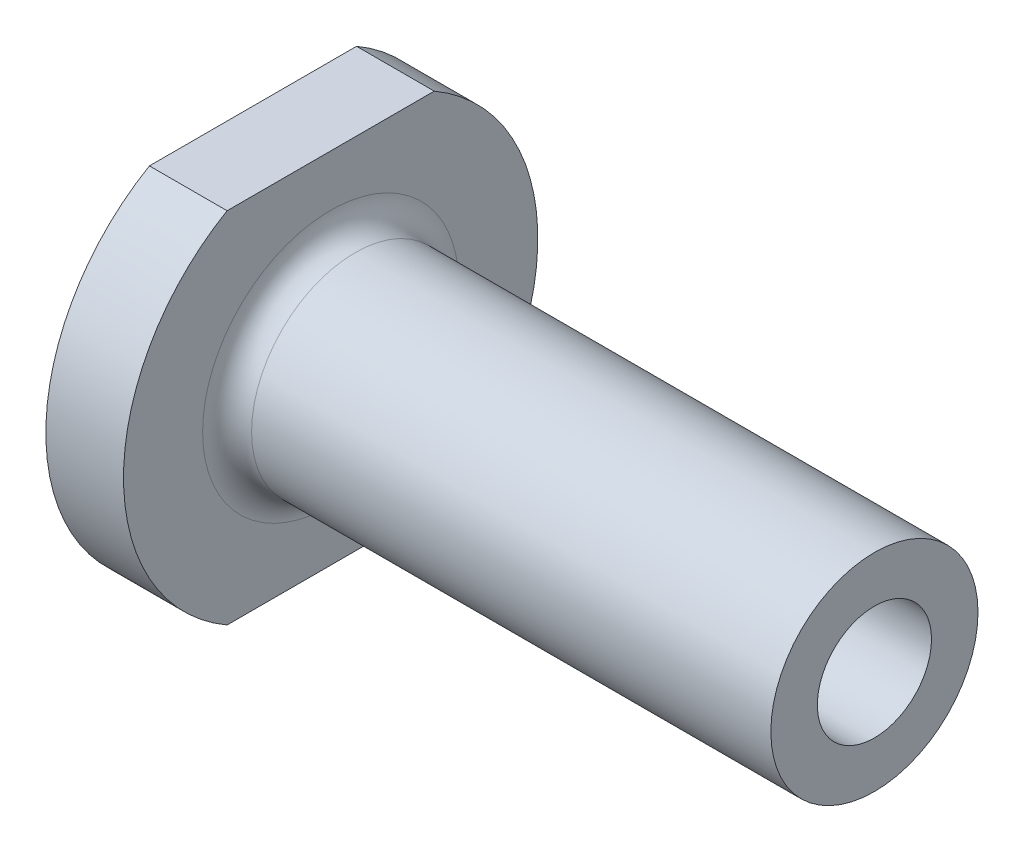
from build123d import *

# Parameters (mm, degrees)
FILLET1_R                            = 1.5
F_5_16_18_MAKE_SURE_TO_CHANGE_THIS_D = 7
CUT_EXTRUDE1_DEPTH                   = 43.121134838


with BuildPart() as part:
    # Sketch1 → Revolve1 (revolve)
    with BuildSketch(Plane.XY):
        Polygon((0, 0), (38.1, 0), (38.1, 6.35), (4.7625, 6.35), (4.7625, 12.7), (0, 12.7), align=None)
    revolve(axis=Axis((0, 0, 0), (-1, 0, 0)))

    # Fillet1
    fillet1_edges = [part.edges().sort_by_distance(p)[0] for p in [
        (4.7625, -6.35, 0),
    ]]
    fillet(fillet1_edges, radius=FILLET1_R)

    # 5/16-18 MAKE SURE TO CHANGE THIS (through all)
    with Locations(Plane(origin=(38.1, 0, 0), x_dir=(0, 0, -1), z_dir=(1, 0, 0))):
        with Locations((0, 0)):
            Hole(F_5_16_18_MAKE_SURE_TO_CHANGE_THIS_D / 2)

    # Sketch4 → Cut-Extrude1 (cut, through all)
    with BuildSketch(Plane.ZY):
        with BuildLine():
            Line((-6.35, 10.998522628), (6.35, 10.998522628))
            ThreePointArc((6.35, 10.998522628), (0, 12.7), (-6.35, 10.998522628))
        make_face()
        with BuildLine():
            Line((6.35, -10.998522628), (-6.35, -10.998522628))
            ThreePointArc((-6.35, -10.998522628), (0, -12.7), (6.35, -10.998522628))
        make_face()
    extrude(amount=-CUT_EXTRUDE1_DEPTH, mode=Mode.SUBTRACT)


solid = part.part
